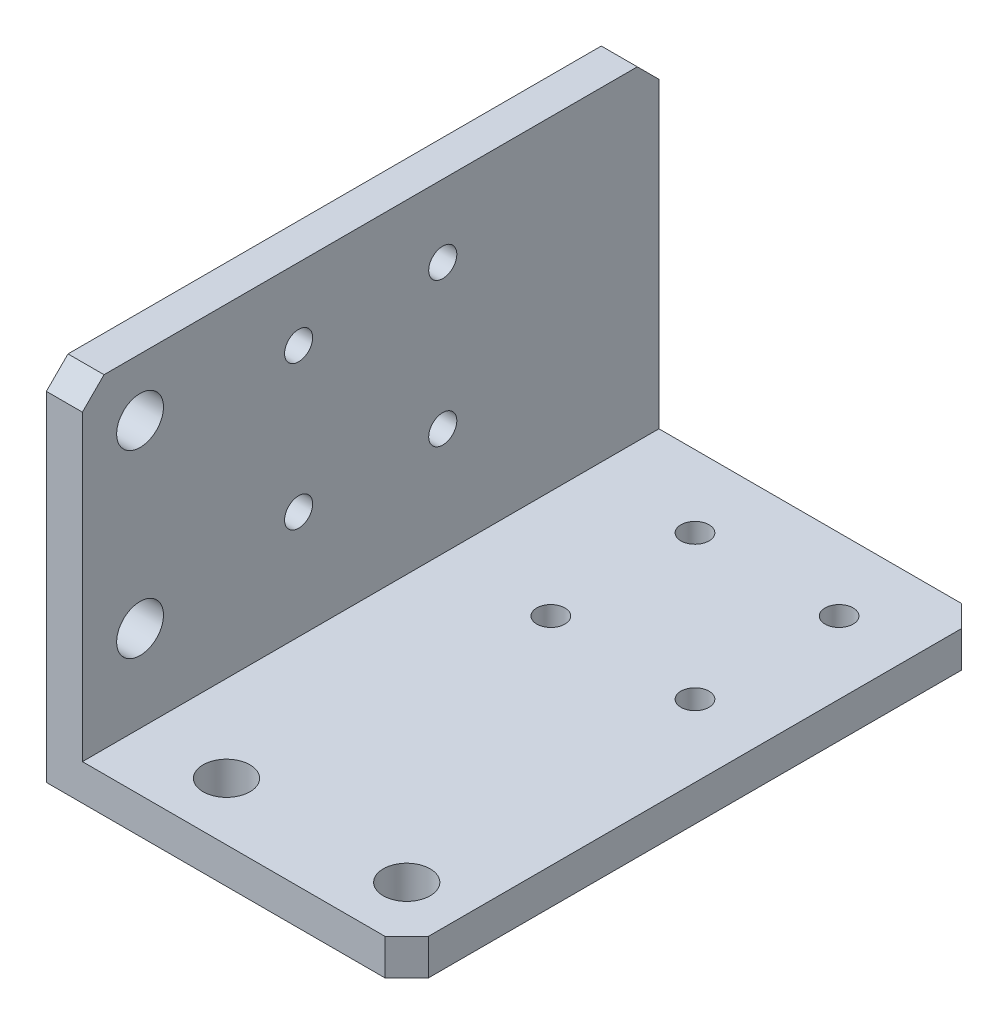
from build123d import *

# Parameters (mm, degrees)
ESTRUSIONE_ESTRUSIONE1_DEPTH = 80
FORO_6_5_6_5_1_D             = 6.5
FORO_6_5_6_5_2_D             = 6.5
FORO_6_5_6_5_2_DEPTH         = 5
FORO_6_5_6_5_2_TIP           = 1.952797012
SMUSSO1_SIZE                 = 3
M3_5_CLEARANCE_HOLE1_D       = 3.9
M3_5_CLEARANCE_HOLE2_D       = 3.9


with BuildPart() as part:
    # Schizzo1 → Estrusione-Estrusione1 (new body)
    with BuildSketch(Plane.XY):
        Polygon((0, 0), (0, 50), (5, 50), (5, 5), (50, 5), (50, 0), align=None)
    extrude(amount=ESTRUSIONE_ESTRUSIONE1_DEPTH)

    # Foro Ø6.5 (6.5)-1 (through all)
    with Locations(Plane(origin=(0, 0, 0), x_dir=(-1, 0, 0), z_dir=(0, -1, 0))):
        with Locations((-17, -72), (-42, -72)):
            Hole(FORO_6_5_6_5_1_D / 2)

    # Foro Ø6.5 (6.5)-2
    with Locations(Plane.ZY):
        with Locations((72, 42), (72, 17)):
            Hole(FORO_6_5_6_5_2_D / 2, depth=FORO_6_5_6_5_2_DEPTH)
            with Locations((0, 0, -(FORO_6_5_6_5_2_DEPTH + FORO_6_5_6_5_2_TIP / 2))):  # 118° drill point
                Cone(0, FORO_6_5_6_5_2_D / 2, FORO_6_5_6_5_2_TIP, mode=Mode.SUBTRACT)

    # Smusso1
    smusso1_edges = [part.edges().sort_by_distance(p)[0] for p in [
        (2.5, 50, 0),
        (50, 2.5, 0),
        (50, 2.5, 80),
        (2.5, 50, 80),
    ]]
    chamfer(smusso1_edges, length=SMUSSO1_SIZE)

    # M3.5 Clearance Hole1 (through all)
    with Locations(Plane(origin=(20, 0, 30), x_dir=(-1, 0, 0), z_dir=(0, -1, 0))):
        with Locations((0, 0), (-20, 0), (-20, 20), (0, 20)):
            Hole(M3_5_CLEARANCE_HOLE1_D / 2)

    # M3.5 Clearance Hole2 (through all)
    with Locations(Plane(origin=(0, 40, 30), x_dir=(0, 0, -1), z_dir=(-1, 0, 0))):
        with Locations((0, 0), (-20, 0), (-20, 20), (0, 20)):
            Hole(M3_5_CLEARANCE_HOLE2_D / 2)


solid = part.part
